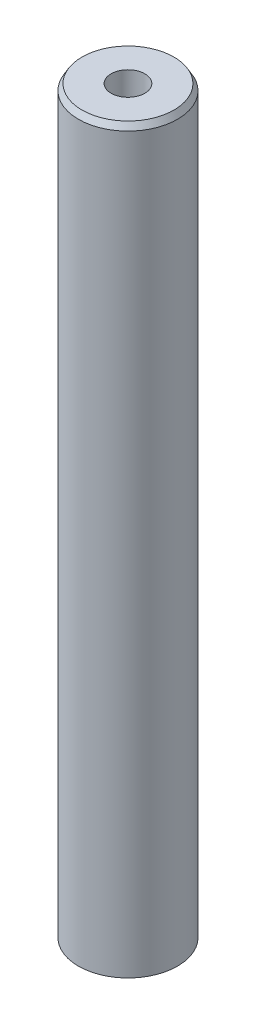
from build123d import *
from OCP.BRepFilletAPI import BRepFilletAPI_MakeChamfer

# Parameters (mm, degrees)
SKETCH1_R           = 40
BOSS_EXTRUDE1_DEPTH = 600
SKETCH2_R           = 13.634122563
CUT_EXTRUDE1_DEPTH  = 603.660766933
CHAMFER1_SIZE       = 5.004938251
CHAMFER1_SIZE2      = 2.889602446


with BuildPart() as part:
    # Sketch1 → Boss-Extrude1 (new body)
    with BuildSketch(Plane(origin=(0, 0, 0), x_dir=(1, 0, 0), z_dir=(0, 1, 0))):
        Circle(SKETCH1_R)
    extrude(amount=BOSS_EXTRUDE1_DEPTH)

    # Sketch2 → Cut-Extrude1 (cut, through all)
    with BuildSketch(Plane(origin=(0, 0, 0), x_dir=(1, 0, 0), z_dir=(0, 1, 0))):
        Circle(SKETCH2_R)
    extrude(amount=CUT_EXTRUDE1_DEPTH, mode=Mode.SUBTRACT)

    # Chamfer1: one chamfer whose edges measure the first distance from different faces: ONE call of the kernel's chamfer builder (chamfer() names one face for all edges)
    chamfer1_edges_1 = [part.edges().sort_by_distance(p)[0] for p in [
        (-40, 600, 0),
    ]]
    chamfer1_side_1 = [part.faces().sort_by_distance(p)[0] for p in [
        (-40, 300, 0),
    ]]
    chamfer1_edges_2 = [part.edges().sort_by_distance(p)[0] for p in [
        (-40, 0, 0),
    ]]
    chamfer1_side_2 = [part.faces().sort_by_distance(p)[0] for p in [
        (-38.86862915, 0, 0),
    ]]
    chamfer1 = BRepFilletAPI_MakeChamfer(part.part.solid().wrapped)
    for e in chamfer1_edges_1:
        chamfer1.Add(CHAMFER1_SIZE, CHAMFER1_SIZE2, e.wrapped, chamfer1_side_1[0].wrapped)  # the first distance lies on this face
    for e in chamfer1_edges_2:
        chamfer1.Add(CHAMFER1_SIZE, CHAMFER1_SIZE2, e.wrapped, chamfer1_side_2[0].wrapped)  # the first distance lies on this face
    add(Compound.cast(chamfer1.Shape()), mode=Mode.REPLACE)


solid = part.part
